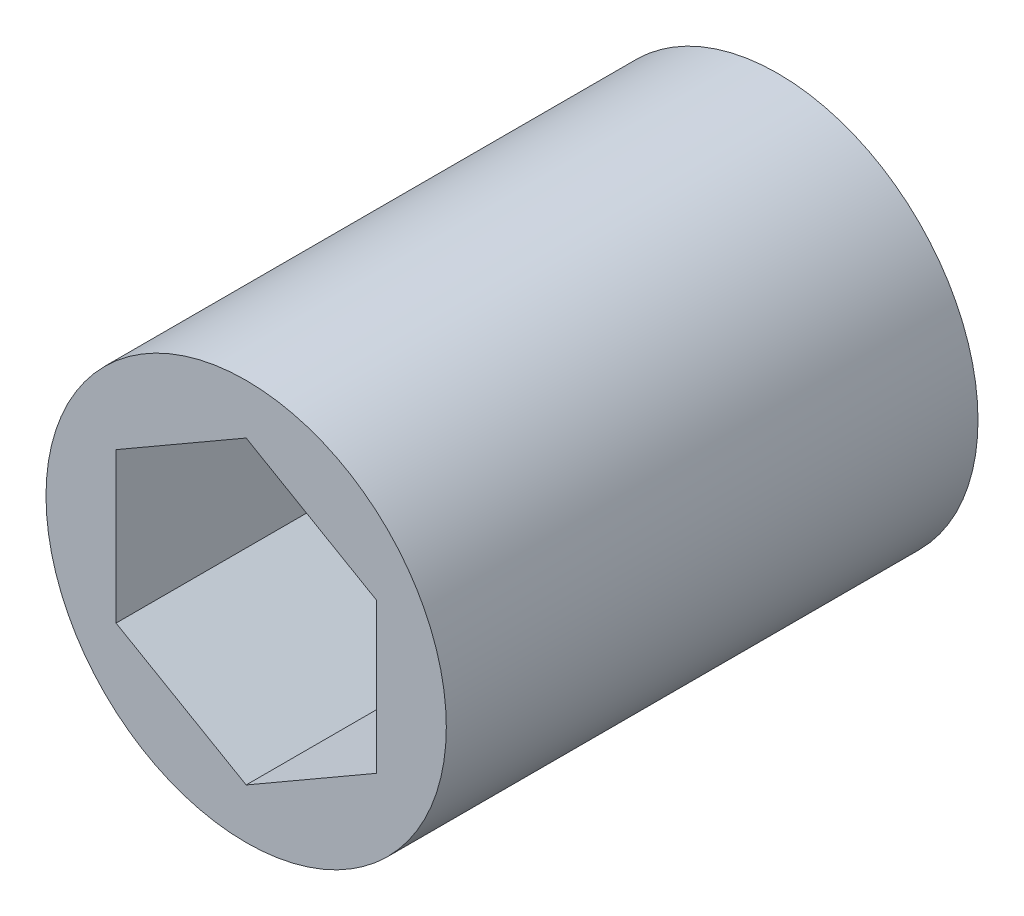
from build123d import *

# Parameters (mm, degrees)
SKETCH1_R           = 10.16
BOSS_EXTRUDE1_DEPTH = 26.9875


with BuildPart() as part:
    # Sketch1 → Boss-Extrude1 (new body)
    with BuildSketch(Plane.XY):
        Circle(SKETCH1_R)
        Polygon((6.604, 3.812821178), (0, 7.625642355), (-6.604, 3.812821178), (-6.604, -3.812821178), (0, -7.625642355), (6.604, -3.812821178), align=None, mode=Mode.SUBTRACT)
    extrude(amount=BOSS_EXTRUDE1_DEPTH)


solid = part.part
